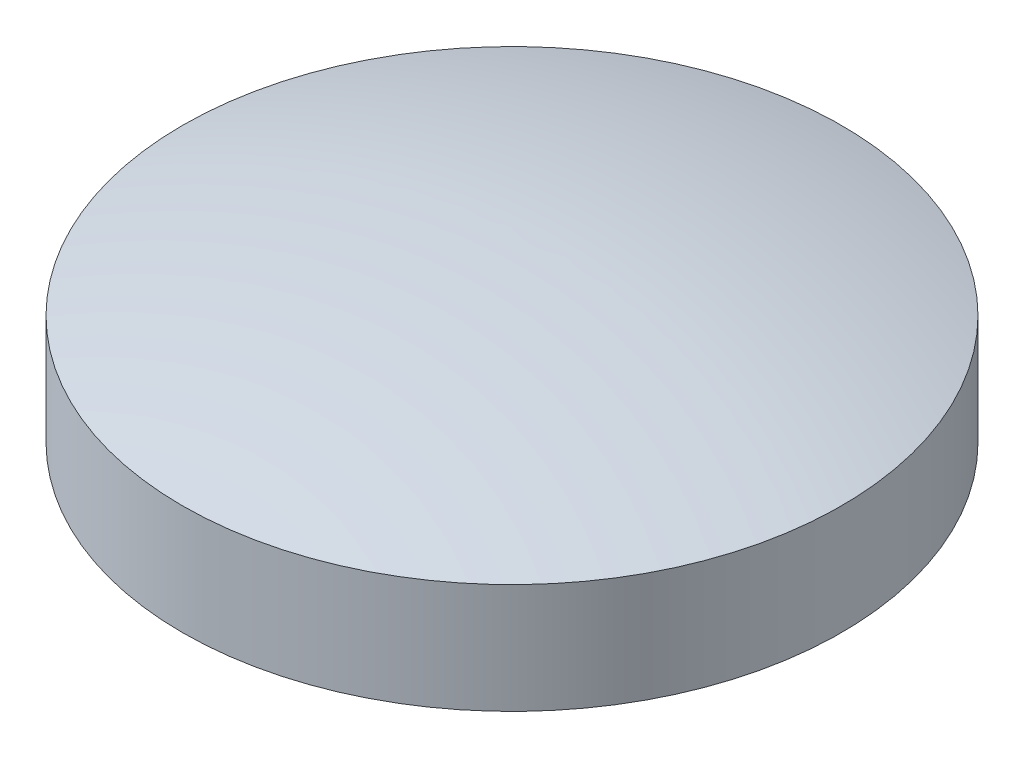
from build123d import *


with BuildPart() as part:
    # 草图1 → 旋转1 (revolve)
    with BuildSketch(Plane.XY):
        with BuildLine():
            ThreePointArc((0, 0.576364791), (-0.910546196, 0.506871146), (-1.8, 0.3))
            Line((-1.8, 0.3), (-1.8, -0.3))
            ThreePointArc((-1.8, -0.3), (-0.910546196, -0.506871146), (0, -0.576364791))
            Line((0, -0.576364791), (0, 0.576364791))
        make_face()
    revolve(axis=Axis((0, 1.107839614, 0), (0, -1, 0)))


solid = part.part
